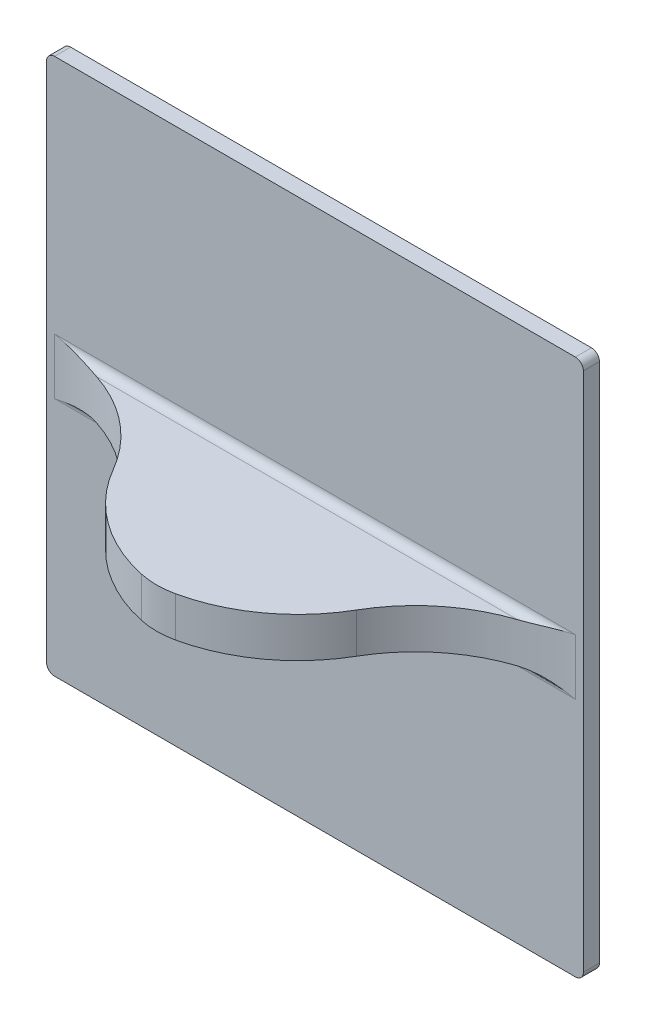
from build123d import *

# Parameters (mm, degrees)
AUFSATZ_LINEAR_AUSTRAGEN1_DEPTH = 2
SKIZZE2_W                       = 25
SKIZZE2_H                       = 5
AUFSATZ_LINEAR_AUSTRAGEN2_DEPTH = 20
VERRUNDUNG1_R                   = 20
VERRUNDUNG2_R                   = 1
VERRUNDUNG3_R                   = 20
VERRUNDUNG4_R                   = 10


# Some blends are built 0.0001 mm under size
with BuildPart() as part:
    # Skizze1 → Aufsatz-Linear austragen1 (new body)
    with BuildSketch(Plane.XY):
        with BuildLine():
            Line((-32.5, -33.5), (32.5, -33.5))
            ThreePointArc((32.5, -33.5), (33.207106781, -33.207106781), (33.5, -32.5))
            Line((33.5, -32.5), (33.5, 32.5))
            ThreePointArc((33.5, 32.5), (33.207106781, 33.207106781), (32.5, 33.5))
            Line((32.5, 33.5), (-32.5, 33.5))
            ThreePointArc((-32.5, 33.5), (-33.207106781, 33.207106781), (-33.5, 32.5))
            Line((-33.5, 32.5), (-33.5, -32.5))
            ThreePointArc((-33.5, -32.5), (-33.207106781, -33.207106781), (-32.5, -33.5))
        make_face()
    extrude(amount=AUFSATZ_LINEAR_AUSTRAGEN1_DEPTH)

    # Skizze2 → Aufsatz-Linear austragen2 (add)
    with BuildSketch(Plane.XY.offset(2)):
        Rectangle(SKIZZE2_W, SKIZZE2_H)
    extrude(amount=AUFSATZ_LINEAR_AUSTRAGEN2_DEPTH)

    # Verrundung1
    verrundung1_edges = [part.edges().sort_by_distance(p)[0] for p in [
        (-12.5, 0, 2),
        (12.5, 0, 2),
    ]]
    fillet(verrundung1_edges, radius=VERRUNDUNG1_R - 0.0001)  # a hair under: the kernel refuses the full size

    # Verrundung2
    verrundung2_edges = [part.edges().sort_by_distance(p)[0] for p in [
        (0, 2.5, 2),
        (0, -2.5, 2),
    ]]
    fillet(verrundung2_edges, radius=VERRUNDUNG2_R)

    # Verrundung3
    # the kernel refuses this fillet: 20 mm, written as the material it takes off along each edge
    with BuildSketch(Plane(origin=(-12.5, 39.102646041, 22), x_dir=(1, 0, 0), z_dir=(0, -1, 0)), Plane(origin=(12.5, -39.102646041, 22), x_dir=(-1, 0, 0), z_dir=(0, 1, 0))) as verrundung3_piece_1:
        with BuildLine():
            CenterArc((14.641058416, -20), VERRUNDUNG3_R, 90, 60.0000827)
            Line((-2.679464093, -10.000025), (-4.411516344, -9.0000275))
            ThreePointArc((-4.411516344, -9.0000275), (-2, -0.0001), (-2, 0))
            Line((-2, 0), (0, 2))
            Line((0, 2), (14.641058416, 2))
            Line((14.641058416, 2), (14.641058416, 0))
        make_face()
    extrude(amount=78.205292082, mode=Mode.SUBTRACT)

    # Verrundung4
    verrundung4_edges = [part.edges().sort_by_distance(p)[0] for p in [
        (0, 0, 21.885066479),
    ]]
    fillet(verrundung4_edges, radius=VERRUNDUNG4_R)


solid = part.part
